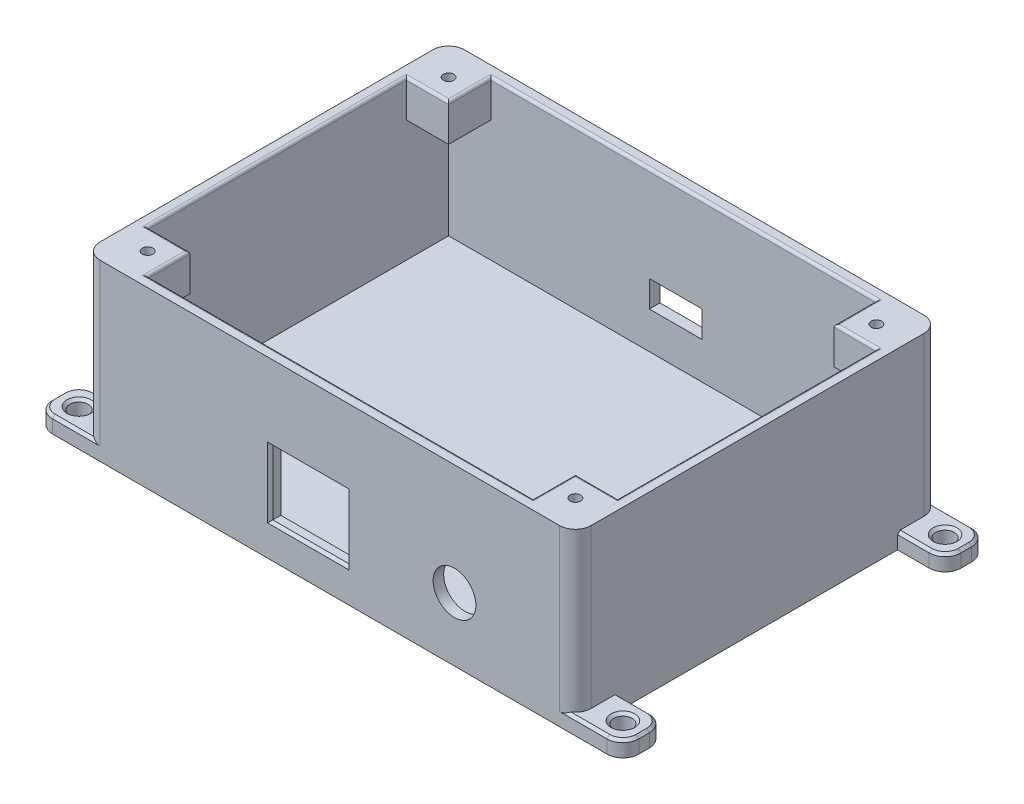
from build123d import *

# Parameters (mm, degrees)
SKETCH1_R           = 1.75
BOSS_EXTRUDE1_DEPTH = 3
SKETCH2_W           = 92.99999868
SKETCH2_H           = 69.000001
SKETCH2_W_2         = 88.99999868
SKETCH2_H_2         = 65.000001
BOSS_EXTRUDE2_DEPTH = 30
SKETCH3_W           = 8
SKETCH3_H           = 8
SKETCH3_R           = 1
BOSS_EXTRUDE3_DEPTH = 15
CHAMFER1_SIZE       = 8
SKETCH4_R           = 3.25
CUT_EXTRUDE1_DEPTH  = 2
SKETCH5_W           = 14.3952
SKETCH5_H           = 12.269740894
CUT_EXTRUDE2_DEPTH  = 2
CHAMFER2_SIZE       = 0.5
FILLET1_R           = 3
CHAMFER4_SIZE       = 0.5
FILLET2_R           = 0.5
SKETCH6_R           = 4.05
CUT_EXTRUDE3_DEPTH  = 2
SKETCH7_W           = 10
SKETCH7_H           = 5
CUT_EXTRUDE4_DEPTH  = 2


with BuildPart() as part:
    # Sketch1 → Boss-Extrude1 (new body)
    with BuildSketch(Plane(origin=(0, 28.706829644, 0), x_dir=(-1, 0, 0), z_dir=(0, -1, 0))):
        with BuildLine():
            Line((27.769470492, -88.753133266), (-65.230528188, -88.753133266))
            Line((-65.230528188, -88.753133266), (-71.230528188, -88.753133266))
            ThreePointArc((-71.230528188, -88.753133266), (-73.351848531, -87.874453609), (-74.230528188, -85.753133266))
            Line((-74.230528188, -85.753133266), (-74.230528188, -83.753133266))
            ThreePointArc((-74.230528188, -83.753133266), (-73.351848531, -81.631812922), (-71.230528188, -80.753133266))
            Line((-71.230528188, -80.753133266), (-65.230528188, -80.753133266))
            Line((-65.230528188, -80.753133266), (-65.230528188, -27.753132266))
            Line((-65.230528188, -27.753132266), (-71.230528188, -27.753132266))
            ThreePointArc((-71.230528188, -27.753132266), (-73.351848531, -26.874452609), (-74.230528188, -24.753132266))
            Line((-74.230528188, -24.753132266), (-74.230528188, -22.753132266))
            ThreePointArc((-74.230528188, -22.753132266), (-73.351848531, -20.631811922), (-71.230528188, -19.753132266))
            Line((-71.230528188, -19.753132266), (-65.230528188, -19.753132266))
            Line((-65.230528188, -19.753132266), (27.769470492, -19.753132266))
            Line((27.769470492, -19.753132266), (33.769470492, -19.753132266))
            ThreePointArc((33.769470492, -19.753132266), (35.890790836, -20.631811922), (36.769470492, -22.753132266))
            Line((36.769470492, -22.753132266), (36.769470492, -24.753132266))
            ThreePointArc((36.769470492, -24.753132266), (35.890790836, -26.874452609), (33.769470492, -27.753132266))
            Line((33.769470492, -27.753132266), (27.769470492, -27.753132266))
            Line((27.769470492, -27.753132266), (27.769470492, -80.753133266))
            Line((27.769470492, -80.753133266), (33.769470492, -80.753133266))
            ThreePointArc((33.769470492, -80.753133266), (35.890790836, -81.631812922), (36.769470492, -83.753133266))
            Line((36.769470492, -83.753133266), (36.769470492, -85.753133266))
            ThreePointArc((36.769470492, -85.753133266), (35.890790836, -87.874453609), (33.769470492, -88.753133266))
            Line((33.769470492, -88.753133266), (27.769470492, -88.753133266))
        make_face()
        with Locations(Location((32.769470492, -23.753132266, 0), (0, 0, 180))):
            Circle(SKETCH1_R, mode=Mode.SUBTRACT)
        with Locations((-70.230528188, -23.753132266)):
            Circle(SKETCH1_R, mode=Mode.SUBTRACT)
        with Locations(Location((-70.230528188, -84.753133266, 0), (0, 0, 180))):
            Circle(SKETCH1_R, mode=Mode.SUBTRACT)
        with Locations((32.769470492, -84.753133266)):
            Circle(SKETCH1_R, mode=Mode.SUBTRACT)
    extrude(amount=BOSS_EXTRUDE1_DEPTH)

    # Sketch2 → Boss-Extrude2 (add)
    with BuildSketch(Plane(origin=(0, 28.706829644, 0), x_dir=(1, 0, 0), z_dir=(0, 1, 0))):
        with Locations((18.730528848, -54.253132766)):
            Rectangle(SKETCH2_W, SKETCH2_H)
        with Locations((18.730528848, -54.253132766)):
            Rectangle(SKETCH2_W_2, SKETCH2_H_2, mode=Mode.SUBTRACT)
    extrude(amount=BOSS_EXTRUDE2_DEPTH)

    # Sketch3 → Boss-Extrude3 (add)
    # profile 1 of 4: a face of its own
    with BuildSketch(Plane(origin=(0, 58.706829644, 0), x_dir=(1, 0, 0), z_dir=(0, 1, 0))):
        with Locations((-21.769470492, -25.753132266)):
            Rectangle(SKETCH3_W, SKETCH3_H)
        with Locations(Location((-21.769470492, -25.753132266, 0), (0, 0, 180))):
            Circle(SKETCH3_R, mode=Mode.SUBTRACT)
    # profile 2 of 4: a face of its own
    with BuildSketch(Plane(origin=(0, 58.706829644, 0), x_dir=(1, 0, 0), z_dir=(0, 1, 0))):
        with Locations((59.230528188, -25.753132266)):
            Rectangle(SKETCH3_W, SKETCH3_H)
        with Locations((59.230528188, -25.753132266)):
            Circle(SKETCH3_R, mode=Mode.SUBTRACT)
    # profile 3 of 4: a face of its own
    with BuildSketch(Plane(origin=(0, 58.706829644, 0), x_dir=(1, 0, 0), z_dir=(0, 1, 0))):
        with Locations((59.230528188, -82.753133266)):
            Rectangle(SKETCH3_W, SKETCH3_H)
        with Locations(Location((59.230528188, -82.753133266, 0), (0, 0, 180))):
            Circle(SKETCH3_R, mode=Mode.SUBTRACT)
    # profile 4 of 4: a face of its own
    with BuildSketch(Plane(origin=(0, 58.706829644, 0), x_dir=(1, 0, 0), z_dir=(0, 1, 0))):
        with Locations((-21.769470492, -82.753133266)):
            Rectangle(SKETCH3_W, SKETCH3_H)
        with Locations((-21.769470492, -82.753133266)):
            Circle(SKETCH3_R, mode=Mode.SUBTRACT)
    extrude(amount=-BOSS_EXTRUDE3_DEPTH)

    # Chamfer1
    # the kernel refuses this chamfer: 8 mm, written as the material it takes off along each edge
    with BuildSketch(Plane(origin=(-17.769470492, 43.706829644, 21.753132266), x_dir=(-0.9996219169112963, -0.027495876610600302, 0), z_dir=(0, 0, 1)), Plane(origin=(2.803993411, 43.706829644, 29.753132266), x_dir=(0, -0.027495876610596853, -0.9996219169112965), z_dir=(-1, 0, 0)), Plane(origin=(2.803993411, 43.706829644, 78.753133266), x_dir=(-1.3984416378867394e-14, 0.9996219169112965, -0.027495876610597703), z_dir=(-1, 0, 0)), Plane(origin=(-17.769470492, 43.706829644, 86.753133266), x_dir=(0.02749587661057268, 0.9996219169112972, -1.045466831585503e-14), z_dir=(0, 0, -1)), Plane(origin=(34.657064284, 43.706829644, 29.753132266), x_dir=(-1.4167575710639342e-14, 0.999621916911297, 0.0274958766105757), z_dir=(1, 0, 0)), Plane(origin=(55.230528188, 43.706829644, 21.753132266), x_dir=(-0.027495876610600312, 0.9996219169112963, -1.0650038269745103e-14), z_dir=(0, 0, 1))) as chamfer1_piece_1:
        Polygon((CHAMFER1_SIZE * 0.999621916911, -CHAMFER1_SIZE * 0.0274958766106), (-CHAMFER1_SIZE * 0.0274958766106, -CHAMFER1_SIZE * 0.999621916911), (0, 0), align=None)
    extrude(amount=28.573463904, mode=Mode.SUBTRACT)
    with BuildSketch(Plane(origin=(55.230528188, 43.706829644, 86.753133266), x_dir=(-0.027495876610600312, 0.9996219169112963, -1.0259298361964941e-14), z_dir=(0, 0, -1)), Plane(origin=(34.657064284, 43.706829644, 78.753133266), x_dir=(-1.4082101355812438e-14, 0.9996219169112965, -0.027495876610597703), z_dir=(1, 0, 0))) as chamfer1_piece_2:
        Polygon((CHAMFER1_SIZE * 0.999621916911, CHAMFER1_SIZE * 0.0274958766106), (-CHAMFER1_SIZE * 0.0274958766106, CHAMFER1_SIZE * 0.999621916911), (0, 0), align=None)
    extrude(amount=28.573463904, mode=Mode.SUBTRACT)

    # Sketch4 → Cut-Extrude1 (cut)
    with BuildSketch(Plane(origin=(0, 0, 19.753132266), x_dir=(-1, 0, 0), z_dir=(0, 0, -1))):
        with Locations(Location((-46.555528188, 33.301829644, 0), (0, 0, 90))):
            Circle(SKETCH4_R)
    extrude(amount=-CUT_EXTRUDE1_DEPTH, mode=Mode.SUBTRACT)

    # Sketch5 → Cut-Extrude2 (cut)
    with BuildSketch(Plane.XY.offset(88.753133266)):
        with Locations((14.645530209, 38.12231703)):
            Rectangle(SKETCH5_W, SKETCH5_H)
    extrude(amount=-CUT_EXTRUDE2_DEPTH, mode=Mode.SUBTRACT)

    # Chamfer2
    chamfer2_edges = [part.edges().sort_by_distance(p)[0] for p in [
        (7.447930209, 38.12231703, 88.753133266),
        (14.645530209, 31.987446583, 88.753133266),
        (21.843130209, 38.12231703, 88.753133266),
        (14.645530209, 44.257187477, 88.753133266),
    ]]
    chamfer(chamfer2_edges, length=CHAMFER2_SIZE)

    # Fillet1
    fillet1_edges = [part.edges().sort_by_distance(p)[0] for p in [
        (-27.769470492, 43.706829644, 19.753132266),
        (-27.769470492, 43.706829644, 88.753133266),
        (65.230528188, 43.706829644, 88.753133266),
        (65.230528188, 43.706829644, 19.753132266),
    ]]
    fillet(fillet1_edges, radius=FILLET1_R)

    # Chamfer4
    chamfer4_edges = [part.edges().sort_by_distance(p)[0] for p in [
        (66.730528188, 28.706829644, 88.753133266),
        (73.351848531, 28.706829644, 87.874453609),
        (74.230528188, 28.706829644, 84.753133266),
        (73.351848531, 28.706829644, 81.631812922),
        (68.230528188, 28.706829644, 80.753133266),
        (68.230528188, 28.706829644, 27.753132266),
        (73.351848531, 28.706829644, 26.874452609),
        (74.230528188, 28.706829644, 23.753132266),
        (73.351848531, 28.706829644, 20.631811922),
        (-29.269470492, 28.706829644, 19.753132266),
        (-35.890790836, 28.706829644, 20.631811922),
        (-36.769470492, 28.706829644, 23.753132266),
        (-35.890790836, 28.706829644, 26.874452609),
        (-30.769470492, 28.706829644, 27.753132266),
        (-30.769470492, 28.706829644, 80.753133266),
        (-35.890790836, 28.706829644, 81.631812922),
        (-36.769470492, 28.706829644, 84.753133266),
        (-35.890790836, 28.706829644, 87.874453609),
        (-34.519470492, 28.706829644, 23.753132266),
        (71.980528188, 28.706829644, 23.753132266),
        (68.480528188, 28.706829644, 84.753133266),
        (-31.019470492, 28.706829644, 84.753133266),
        (-29.269470492, 28.706829644, 88.753133266),
        (66.730528188, 28.706829644, 19.753132266),
    ]]
    chamfer(chamfer4_edges, length=CHAMFER4_SIZE)

    # Fillet2
    fillet2_edges = [part.edges().sort_by_distance(p)[0] for p in [
        (-25.769470492, 58.706829644, 54.253132766),
        (-21.769470492, 58.706829644, 29.753132266),
        (-17.769470492, 58.706829644, 25.753132266),
        (18.730528848, 58.706829644, 21.753132266),
        (55.230528188, 58.706829644, 25.753132266),
        (59.230528188, 58.706829644, 29.753132266),
        (63.230528188, 58.706829644, 54.253132766),
        (59.230528188, 58.706829644, 78.753133266),
        (55.230528188, 58.706829644, 82.753133266),
        (18.730528848, 58.706829644, 86.753133266),
        (-17.769470492, 58.706829644, 82.753133266),
        (-21.769470492, 58.706829644, 78.753133266),
    ]]
    fillet(fillet2_edges, radius=FILLET2_R)

    # Sketch6 → Cut-Extrude3 (cut)
    with BuildSketch(Plane.XY.offset(88.753133266)):
        with Locations((42.343130209, 37.706829644)):
            Circle(SKETCH6_R)
    extrude(amount=-CUT_EXTRUDE3_DEPTH, mode=Mode.SUBTRACT)

    # Sketch7 → Cut-Extrude4 (cut)
    with BuildSketch(Plane(origin=(0, 0, 19.753132266), x_dir=(-1, 0, 0), z_dir=(0, 0, -1))):
        with Locations((-17.230528188, 38.206829644)):
            Rectangle(SKETCH7_W, SKETCH7_H)
    extrude(amount=-CUT_EXTRUDE4_DEPTH, mode=Mode.SUBTRACT)


solid = part.part
